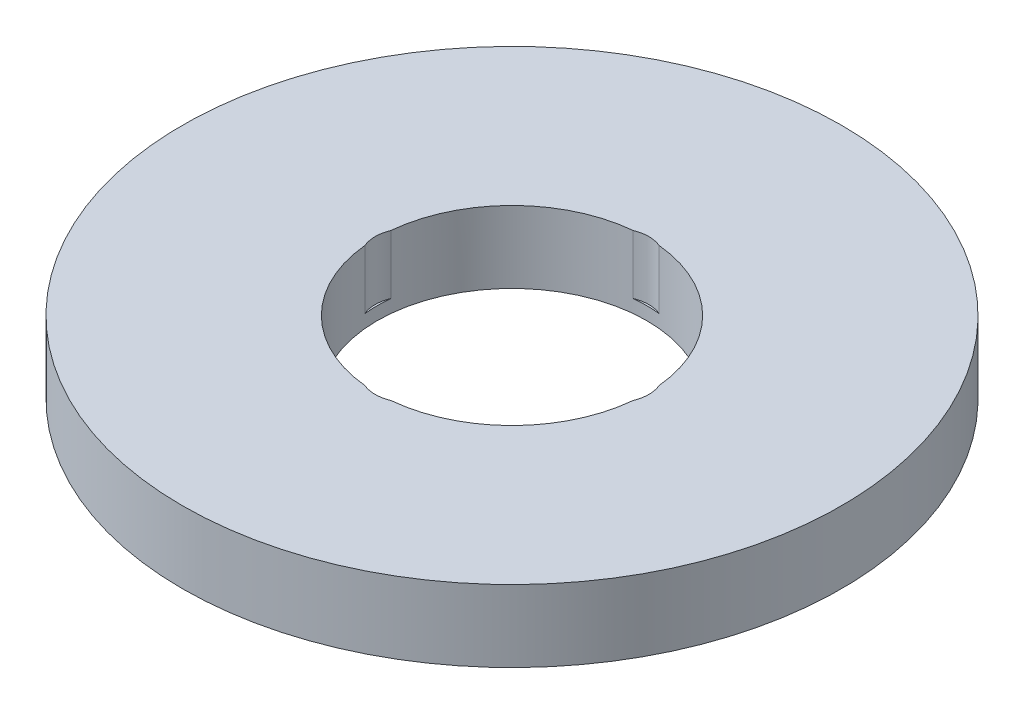
from build123d import *

# Parameters (mm, degrees)
SKETCH1_R           = 55
BOSS_EXTRUDE1_DEPTH = 12
SKETCH2_R           = 22.5
CUT_EXTRUDE1_DEPTH  = 79.70196948
SKETCH3_R           = 5.589809808
CUT_EXTRUDE2_DEPTH  = 9.832938063
CIRPATTERN1_COUNT   = 4


with BuildPart() as part:
    # Sketch1 → Boss-Extrude1 (new body)
    with BuildSketch(Plane(origin=(0, 0, 0), x_dir=(1, 0, 0), z_dir=(0, 1, 0))):
        Circle(SKETCH1_R)
    extrude(amount=BOSS_EXTRUDE1_DEPTH)

    # Sketch2 → Cut-Extrude1 (cut, through all)
    with BuildSketch(Plane(origin=(0, 0, 0), x_dir=(1, 0, 0), z_dir=(0, 1, 0))):
        Circle(SKETCH2_R)
    extrude(amount=CUT_EXTRUDE1_DEPTH, mode=Mode.SUBTRACT)

    # Sketch3 → Cut-Extrude2 (cut)
    with BuildSketch(Plane(origin=(0, 12, 0), x_dir=(1, 0, 0), z_dir=(0, 1, 0))):
        with Locations((-17.24204606, 0)):
            Circle(SKETCH3_R)
    cut_extrude2 = extrude(amount=-CUT_EXTRUDE2_DEPTH, mode=Mode.SUBTRACT)

    # CirPattern1: Cut-Extrude2 ×4 about axis
    cirpattern1_axis = Axis((0, 0, 0), (0, 1, 0))
    for i in range(1, CIRPATTERN1_COUNT):
        add(cut_extrude2.rotate(cirpattern1_axis, i * 360 / CIRPATTERN1_COUNT), mode=Mode.SUBTRACT)


solid = part.part
